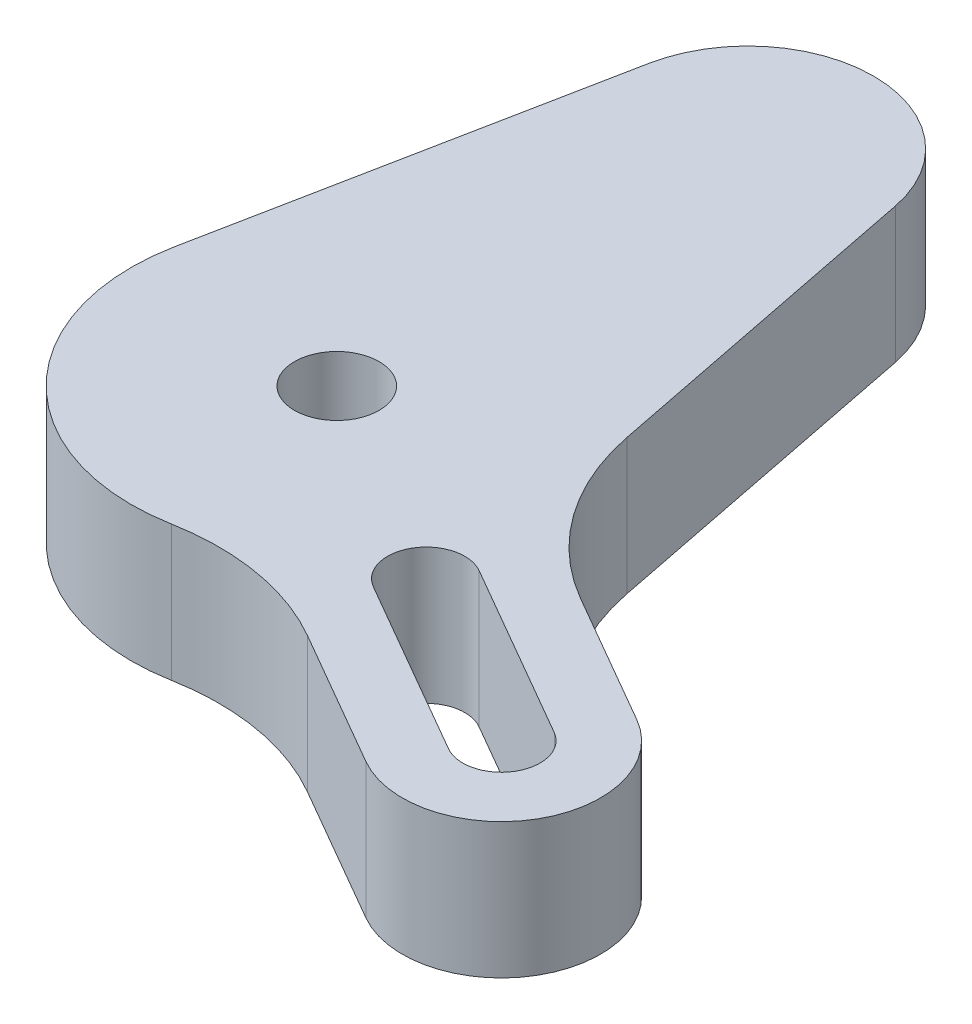
from build123d import *

# Parameters (mm, degrees)
EXTRUDE_THIN1_DEPTH = 2.6
BOSS_EXTRUDE1_DEPTH = 3
EXTRUDE_THIN2_DEPTH = 5.6
SKETCH5_R           = 1.75
CUT_EXTRUDE1_DEPTH  = 31.537946797
FILLET1_R           = 10


# Read off the part's stored shape, not the designer's step: Extrude-Thin1
with BuildPart() as part:
    # Extrude-Thin1 outline → Extrude-Thin1 (new body)
    with BuildSketch(Plane(origin=(0, 0, 0), x_dir=(1, 0, 0), z_dir=(0, 1, 0))):
        with BuildLine():
            ThreePointArc((5.101086932, 18.009411765), (0, 22.2), (-5.101086932, 18.009411765))
            Line((-5.101086932, 18.009411765), (-8.338315178, 1.65))
            ThreePointArc((-8.338315178, 1.65), (0, -8.5), (8.338315178, 1.65))
            Line((8.338315178, 1.65), (5.101086932, 18.009411765))
        make_face()
        with BuildLine():
            Line((-5.885869537, 1.164705882), (-2.648641292, 17.524117647))
            ThreePointArc((-2.648641292, 17.524117647), (0, 19.7), (2.648641292, 17.524117647))
            Line((2.648641292, 17.524117647), (5.885869537, 1.164705882))
            ThreePointArc((5.885869537, 1.164705882), (0, -6), (-5.885869537, 1.164705882))
        make_face(mode=Mode.SUBTRACT)
    extrude(amount=EXTRUDE_THIN1_DEPTH)

    # Sketch2 → Boss-Extrude1 (add)
    # profile 1 of 2: a face of its own
    with BuildSketch(Plane(origin=(0, 2.6, 0), x_dir=(1, 0, 0), z_dir=(0, 1, 0))):
        with BuildLine():
            Line((8.338315178, 1.65), (5.101086932, 18.009411765))
            ThreePointArc((5.101086932, 18.009411765), (0, 22.2), (-5.101086932, 18.009411765))
            Line((-5.101086932, 18.009411765), (-8.338315178, 1.65))
            ThreePointArc((-8.338315178, 1.65), (0, -8.5), (8.338315178, 1.65))
        make_face()
        with BuildLine():
            ThreePointArc((5.885869537, 1.164705882), (0, -6), (-5.885869537, 1.164705882))
            Line((-5.885869537, 1.164705882), (-2.648641292, 17.524117647))
            ThreePointArc((-2.648641292, 17.524117647), (0, 19.7), (2.648641292, 17.524117647))
            Line((2.648641292, 17.524117647), (5.885869537, 1.164705882))
        make_face(mode=Mode.SUBTRACT)
    # profile 2 of 2: a face of its own
    with BuildSketch(Plane(origin=(0, 2.6, 0), x_dir=(1, 0, 0), z_dir=(0, 1, 0))):
        with BuildLine():
            Line((-5.885869537, 1.164705882), (-2.648641292, 17.524117647))
            ThreePointArc((-2.648641292, 17.524117647), (0, 19.7), (2.648641292, 17.524117647))
            Line((2.648641292, 17.524117647), (5.885869537, 1.164705882))
            ThreePointArc((5.885869537, 1.164705882), (0, -6), (-5.885869537, 1.164705882))
        make_face()
    extrude(amount=BOSS_EXTRUDE1_DEPTH)

    # Sketch4 → Extrude-Thin2 (add, through all)
    with BuildSketch(Plane(origin=(0, 5.6, 0), x_dir=(1, 0, 0), z_dir=(0, 1, 0))):
        with BuildLine():
            Line((10.796856578, -1.499295844), (18.15807251, -5.749295844))
            ThreePointArc((18.15807251, -5.749295844), (19.658776666, -11.35), (14.05807251, -12.850704156))
            Line((14.05807251, -12.850704156), (6.696856578, -8.600704156))
            ThreePointArc((6.696856578, -8.600704156), (5.196152423, -3), (10.796856578, -1.499295844))
        make_face()
        with BuildLine():
            Line((9.546856578, -3.664359354), (16.90807251, -7.914359354))
            ThreePointArc((16.90807251, -7.914359354), (17.493713156, -10.1), (15.30807251, -10.685640646))
            Line((15.30807251, -10.685640646), (7.946856578, -6.435640646))
            ThreePointArc((7.946856578, -6.435640646), (7.361215932, -4.25), (9.546856578, -3.664359354))
        make_face(mode=Mode.SUBTRACT)
    extrude(amount=-EXTRUDE_THIN2_DEPTH)

    # Sketch5 → Cut-Extrude1 (cut, through all)
    with BuildSketch(Plane(origin=(0, 5.6, 0), x_dir=(1, 0, 0), z_dir=(0, 1, 0))):
        with Locations(Location((0, 0, 0), (0, 0, 270))):
            Circle(SKETCH5_R)
    extrude(amount=-CUT_EXTRUDE1_DEPTH, mode=Mode.SUBTRACT)

    # Fillet1
    # the kernel refuses this fillet: 10 mm, written as the material it adds along each edge
    with BuildSketch(Plane(origin=(5.055074156, 5.6, 6.833463637), x_dir=(0.7701817690160239, 0, 0.6378244607063513), z_dir=(0, -1, 0))) as fillet1_piece_1_section:
        with BuildLine():
            CenterArc((5.914673675, 9.859092079), FILLET1_R, 220.025396245, 40.344818113)
            Line((-1.74292086, 3.427821136), (-2.508680314, 2.784694042))
            ThreePointArc((-2.508680314, 2.784694042), (-1.566456977, 1.360530409), (-0.970808966, -0.239854019))
            Line((-0.970808966, -0.239854019), (0.416050435, -0.909341539))
            ThreePointArc((0.416050435, -0.909341539), (2.224378819, -0.671981767), (4.074579357, -0.985909208))
            Line((4.074579357, -0.985909208), (4.241860659, 0))
        make_face()
    fillet1_piece_1 = extrude(amount=13.604651647, mode=Mode.PRIVATE)
    fillet1_piece_1 = split(fillet1_piece_1, bisect_by=Plane(origin=(5.032331635, 0, 8.326315452), z_dir=(0, 1, 0)), keep=Keep.TOP, mode=Mode.PRIVATE)
    add(fillet1_piece_1)
    with BuildSketch(Plane(origin=(8.445490183, 5.6, 0.961090818), x_dir=(0.9339582285833896, 0, 0.35738218654736686), z_dir=(0, -1, 0))) as fillet1_piece_2_section:
        with BuildLine():
            CenterArc((6.080721922, -9.875226453), FILLET1_R, 99.060486088, 48.806816394)
            Line((-2.38746333, -4.556407174), (-3.234281856, -4.024525246))
            ThreePointArc((-3.234281856, -4.024525246), (-1.88007285, -1.868465389), (-0.968377858, 0.249488126))
            Line((-0.968377858, 0.249488126), (0.425065104, 0.905162779))
            ThreePointArc((0.425065104, 0.905162779), (2.23094582, 0.649847195), (4.348474242, 0.987522645))
            Line((4.348474242, 0.987522645), (4.505951304, 0))
        make_face()
    fillet1_piece_2 = extrude(amount=15.860022231, mode=Mode.PRIVATE)
    fillet1_piece_2 = split(fillet1_piece_2, bisect_by=Plane(origin=(9.506243906, 0, -0.256428974), z_dir=(0, 1, 0)), keep=Keep.TOP, mode=Mode.PRIVATE)
    add(fillet1_piece_2)


solid = part.part
